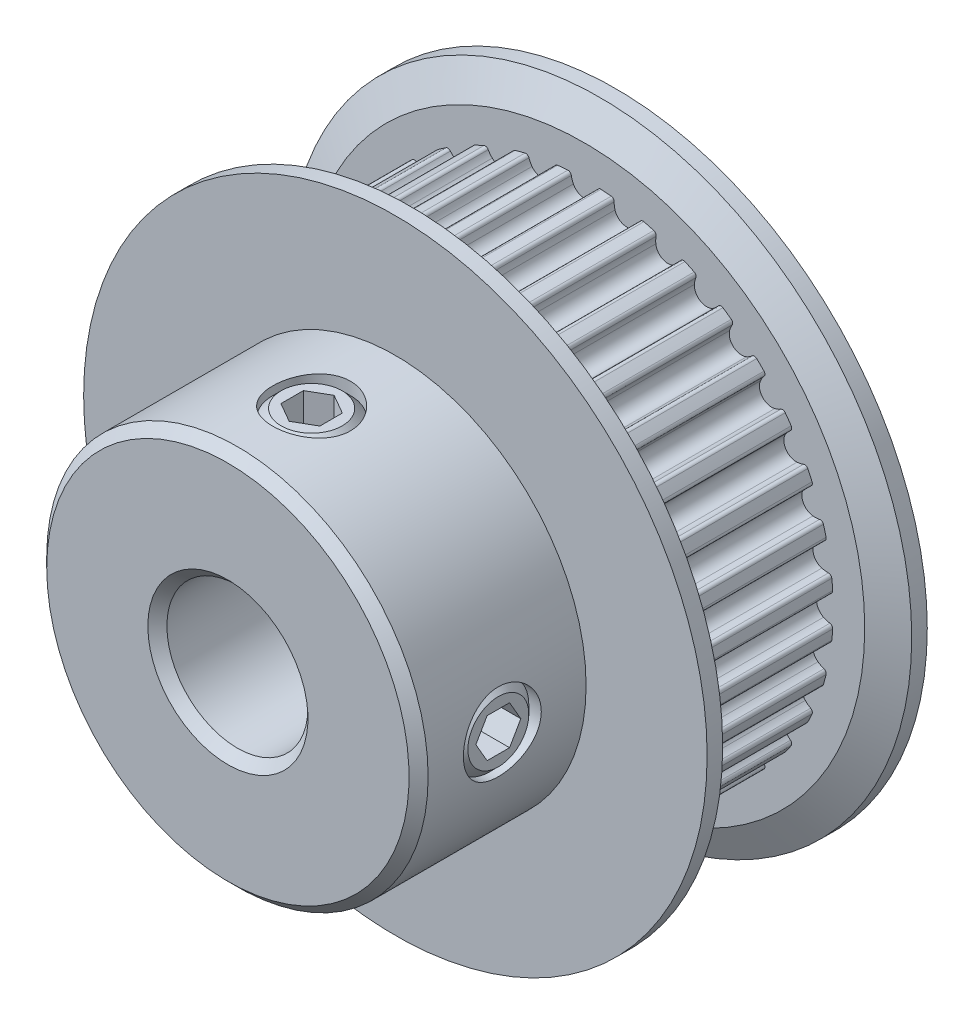
from build123d import *

# Parameters (mm, degrees)
CUT_EXTRUDE1_START = -0.2149
CUT_EXTRUDE1_DEPTH = 7.11
CIRPATTERN1_COUNT  = 36
SKETCH4_R          = 1.7526
CUT_EXTRUDE2_DEPTH = 22.679532387
CUT_EXTRUDE3_DEPTH = 1.31445
CIRPATTERN2_COUNT  = 2
CIRPATTERN2_ANGLE  = 90
CHAMFER1_SIZE      = 0.42925


with BuildPart() as part:
    # Sketch2 → Revolve1 (revolve)
    with BuildSketch(Plane(origin=(0, 0, 0), x_dir=(0, 0, -1), z_dir=(1, 0, 0)), mode=Mode.PRIVATE) as revolve1_sk:
        Polygon((-8.7249, 3.175), (8.7249, 3.175), (8.7249, 14.0335), (8.0249, 14.0335), (7.3249, 12.6175), (7.3249, 11.2015), (0.2149, 11.2015), (0.2149, 12.6175), (-0.4851, 14.0335), (-1.1851, 14.0335), (-1.1851, 8.585), (-8.7249, 8.585), align=None)
    revolve(revolve1_sk.sketch.rotate(Axis((0, 0, 8.7249), (0, 0, -1)), 90), axis=Axis((0, 0, 8.7249), (0, 0, -1)))

    # Sketch3 → Cut-Extrude1 (cut)
    with BuildSketch(Plane.XY.offset(CUT_EXTRUDE1_START)):
        with BuildLine():
            Line((2.47851039, 14.0335), (-2.47851039, 14.0335))
            Line((-2.47851039, 14.0335), (-1.948188905, 11.030782485))
            ThreePointArc((-1.948188905, 11.030782485), (-1.349400228, 11.119924517), (-0.746670105, 11.176586509))
            ThreePointArc((-0.746670105, 11.176586509), (-0.642837821, 11.143946875), (-0.588409912, 11.049691415))
            ThreePointArc((-0.588409912, 11.049691415), (-0.554446301, 10.903117263), (-0.498876404, 10.763297753))
            ThreePointArc((-0.498876404, 10.763297753), (0, 10.4515), (0.498876404, 10.763297753))
            ThreePointArc((0.498876404, 10.763297753), (0.554446301, 10.903117263), (0.588409912, 11.049691415))
            ThreePointArc((0.588409912, 11.049691415), (0.642837821, 11.143946875), (0.746670105, 11.176586509))
            ThreePointArc((0.746670105, 11.176586509), (1.349400228, 11.119924517), (1.948188905, 11.030782485))
            Line((1.948188905, 11.030782485), (2.47851039, 14.0335))
        make_face()
    cut_extrude1 = extrude(amount=-CUT_EXTRUDE1_DEPTH, mode=Mode.SUBTRACT)

    # CirPattern1: Cut-Extrude1 ×36 about axis
    cirpattern1_axis = Axis((0, 0, 0), (0, 0, 1))
    for i in range(1, CIRPATTERN1_COUNT):
        add(cut_extrude1.rotate(cirpattern1_axis, i * 360 / CIRPATTERN1_COUNT), mode=Mode.SUBTRACT)

    # Sketch4 → Cut-Extrude2 (cut, through all)
    with BuildSketch(Plane(origin=(0, 0, 0), x_dir=(0, -1, 0), z_dir=(1, 0, 0))):
        with Locations(Location((0, -4.955, 0), (0, 0, 270.000000003))):
            Circle(SKETCH4_R)
    cut_extrude2 = extrude(amount=CUT_EXTRUDE2_DEPTH, mode=Mode.SUBTRACT)

    # Sketch5 → Revolve2 (revolve)
    with BuildSketch(Plane.XY.offset(4.955), mode=Mode.PRIVATE) as revolve2_sk:
        Polygon((3.175, -1.3716), (3.175, 0), (8.404202415, 0), (8.404202415, -1.3716), (8.023202415, -1.7526), (3.556, -1.7526), align=None)
    revolve2 = revolve(revolve2_sk.sketch.rotate(Axis((3.175, 0, 4.955), (1, 0, 0)), 270), axis=Axis((3.175, 0, 4.955), (1, 0, 0)))

    # Sketch6 → Cut-Extrude3 (cut)
    with BuildSketch(Plane(origin=(8.404202415, 5.384140679, 0), x_dir=(0, -1, 0), z_dir=(-1, 0, 0))):
        Polygon((5.384140679, 5.966864082), (4.507840679, 5.460932041), (4.507840679, 4.449067959), (5.384140679, 3.943135918), (6.260440679, 4.449067959), (6.260440679, 5.460932041), align=None)
    cut_extrude3 = extrude(amount=CUT_EXTRUDE3_DEPTH, mode=Mode.SUBTRACT)

    # CirPattern2: Cut-Extrude2, Revolve2, Cut-Extrude3 ×2 about axis
    cirpattern2_axis = Axis((0, 0, 0), (0, 0, 1))
    add([cut_extrude2.rotate(cirpattern2_axis, i * CIRPATTERN2_ANGLE / (CIRPATTERN2_COUNT - 1)) for i in range(1, CIRPATTERN2_COUNT)], mode=Mode.SUBTRACT)
    add([revolve2.rotate(cirpattern2_axis, i * CIRPATTERN2_ANGLE / (CIRPATTERN2_COUNT - 1)) for i in range(1, CIRPATTERN2_COUNT)])
    add([cut_extrude3.rotate(cirpattern2_axis, i * CIRPATTERN2_ANGLE / (CIRPATTERN2_COUNT - 1)) for i in range(1, CIRPATTERN2_COUNT)], mode=Mode.SUBTRACT)

    # Chamfer1
    chamfer1_edges = [part.edges().sort_by_distance(p)[0] for p in [
        (-8.585, 0, 8.7249),
        (-3.175, 0, 8.7249),
    ]]
    chamfer(chamfer1_edges, length=CHAMFER1_SIZE)


solid = part.part
